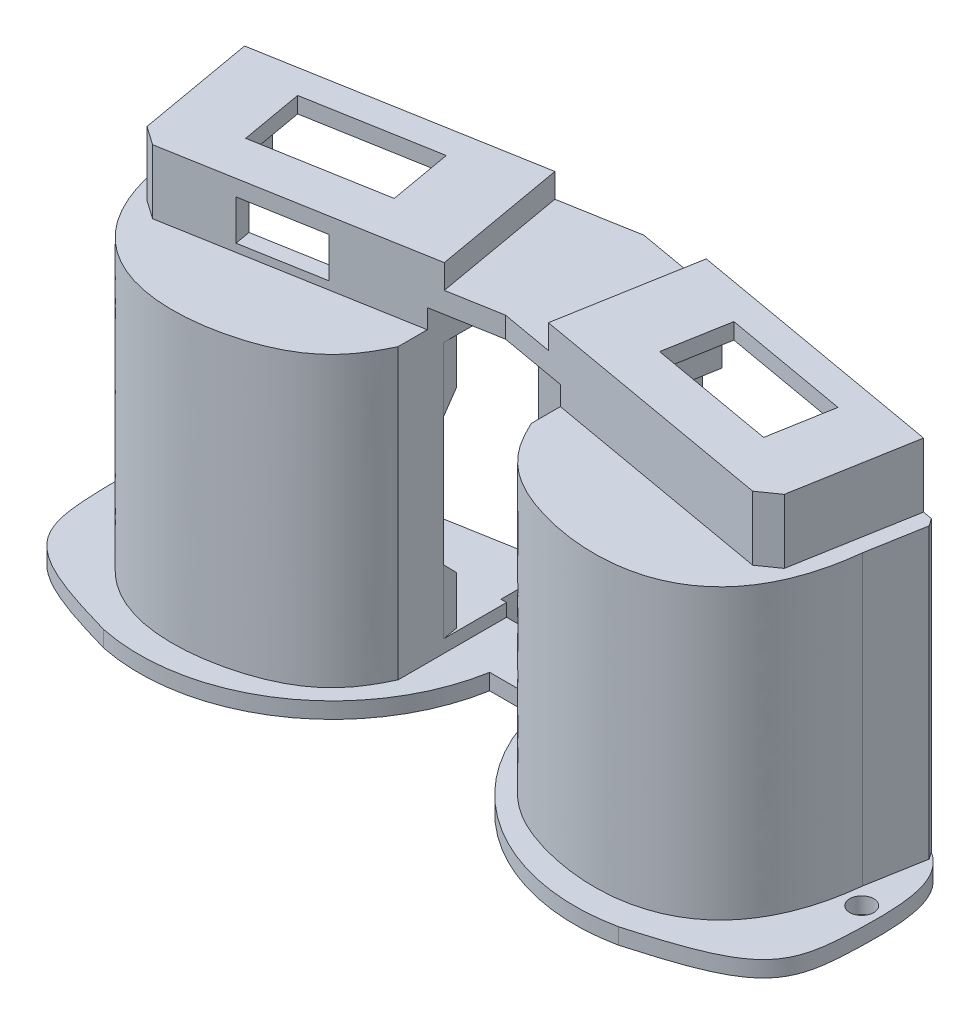
from build123d import *

# Parameters (mm, degrees)
EXTRUDE_1_DEPTH        = 1
EXTRUDE_1_2_DEPTH      = 1
FILLET_1_R             = 2
FILLET_2_R             = 2
SKETCH_6_W             = 6
SKETCH_6_H             = 8
EXTRUDE_2_DEPTH        = 1
EXTRUDE_4_DEPTH        = 18
EXTRUDE_5_DEPTH        = 4
CUT_EXTRUDE_8_DEPTH    = 1.5
SKETCH_24_W            = 8.3
SKETCH_24_H            = 19.2
CUT_EXTRUDE_2271_DEPTH = 10
SKETCH_13_R            = 0.75
CUT_EXTRUDE_14_DEPTH   = 10
SKETCH_29_OUTSIDE_W    = 62.972
SKETCH_29_OUTSIDE_H    = 33.348
CUT_EXTRUDE_20_DEPTH   = 1
SKETCH_25_W            = 9
SKETCH_25_H            = 2
CUT_EXTRUDE_4392_DEPTH = 18
CHAMFER_4_SIZE         = 1
SKETCH_39_W            = 17
SKETCH_39_H            = 16
CUT_EXTRUDE_28_DEPTH   = 7.5
SKETCH_40_W            = 14
SKETCH_40_H            = 4.2
CUT_EXTRUDE_29_DEPTH   = 7.5
SKETCH_43_W            = 3
SKETCH_43_H            = 3
EXTRUDE_10_DEPTH       = 1
SKETCH_44_W            = 4
SKETCH_44_H            = 2.5
EXTRUDE_11_DEPTH       = 1.5
SKETCH_47_R            = 0.5
CUT_EXTRUDE_31_DEPTH   = 2
CUT_EXTRUDE_32_DEPTH   = 6
SKETCH_49_R            = 0.5
CUT_EXTRUDE_33_DEPTH   = 3
SKETCH_50_W            = 5
SKETCH_50_H            = 2.5
CUT_EXTRUDE_34_DEPTH   = 3
CHAMFER_START          = 1
CHAMFER_6_DEPTH        = 19
CHAMFER_7_SIZE         = 1


with BuildPart() as part:
    # 草图1 → 凸台-拉伸1 (new body)
    with BuildSketch(Plane(origin=(0, 0, 0), x_dir=(1, 0, 0), z_dir=(0, 1, 0))):
        with BuildLine():
            Line((2.5, 0), (19.241731801, -2.95201902))
            add(Edge.make_bspline(
                [(16.289712781, -19.693750822), (21.129770718, -18.30937539), (24.365467079, -17.036880795), (24.930319354, -7.375094408), (24.280515787, -3.921767395), (19.241731801, -2.95201902)],
                knots=[0, 0, 0, 0, 0.38424731, 0.48424731, 1, 1, 1, 1], degree=3))
            ThreePointArc((16.289712781, -19.693750822), (2.883637018, -14.406080298), (2.5, 0))
        make_face()
    extrude(amount=EXTRUDE_1_DEPTH)

    # 圆角2
    fillet_2_edges = [part.edges().sort_by_distance(p)[0] for p in [
        (2.5, 0.5, 0),
    ]]
    fillet(fillet_2_edges, radius=FILLET_2_R)



with BuildPart() as body_2:
    # 草图1 → Extrude 1 2 (new body)
    with BuildSketch(Plane(origin=(0, 0, 0), x_dir=(1, 0, 0), z_dir=(0, 1, 0))):
        with BuildLine():
            Line((-2.5, 0), (-19.241731801, -2.95201902))
            add(Edge.make_bspline(
                [(-16.289712781, -19.693750822), (-21.129770718, -18.30937539), (-24.365467079, -17.036880795), (-24.930319354, -7.375094408), (-24.280515787, -3.921767395), (-19.241731801, -2.95201902)],
                knots=[0, 0, 0, 0, 0.38424731, 0.48424731, 1, 1, 1, 1], degree=3))
            ThreePointArc((-16.289712781, -19.693750822), (-2.883637018, -14.406080298), (-2.5, 0))
        make_face()
    extrude(amount=EXTRUDE_1_2_DEPTH)

    # 圆角1
    fillet_1_edges = [body_2.edges().sort_by_distance(p)[0] for p in [
        (-2.5, 0.5, 0),
    ]]
    fillet(fillet_1_edges, radius=FILLET_1_R)


with BuildPart() as part_1:
    add(part.part)

    add(body_2.part)  # 凸台-拉伸2 merges body 2
    # 草图6 → 凸台-拉伸2 (add)
    with BuildSketch(Plane(origin=(0, 0, 0), x_dir=(1, 0, 0), z_dir=(0, 1, 0))):
        with Locations((0, -6)):
            Rectangle(SKETCH_6_W, SKETCH_6_H)
    extrude(amount=EXTRUDE_2_DEPTH)

    # 草图15 → 凸台-拉伸4 (add)
    with BuildSketch(Plane(origin=(0, 1, 0), x_dir=(1, 0, 0), z_dir=(0, 1, 0))):
        with BuildLine():
            Line((0, -1.082322466), (22.158174443, -4.989406464))
            Line((22.158174443, -4.989406464), (21.463581732, -8.928637476))
            add(Edge.make_bspline(
                [(21.463581732, -8.928637476), (20.458963338, -18.100563156), (6.612745785, -17.806779428), (4.545635212, -13.166954204), (2.829361228, -9.295442737), (2.745033676, -8.501050368), (2.954423259, -7.69582667)],
                knots=[0, 0, 0, 0, 0.355715303, 0.690613532, 0.755042002, 1, 1, 1, 1], degree=3))
            Line((2.954423259, -7.69582667), (0, -7.174882137))
            Line((0, -7.174882137), (-2.954423259, -7.69582667))
            add(Edge.make_bspline(
                [(-21.463581732, -8.928637476), (-20.458963338, -18.100563156), (-6.612745785, -17.806779428), (-4.545635212, -13.166954204), (-2.829361228, -9.295442737), (-2.745033676, -8.501050368), (-2.954423259, -7.69582667)],
                knots=[0, 0, 0, 0, 0.355715303, 0.690613532, 0.755042002, 1, 1, 1, 1], degree=3))
            Line((-21.463581732, -8.928637476), (-22.158174443, -4.989406464))
            Line((-22.158174443, -4.989406464), (0, -1.082322466))
        make_face()
    extrude(amount=EXTRUDE_4_DEPTH)

    # 草图16 → 凸台-拉伸5 (add)
    with BuildSketch(Plane(origin=(0, 19, 0), x_dir=(1, 0, 0), z_dir=(0, 1, 0))):
        Polygon((0, -1.082322466), (21.17336669, -4.815758286), (19.69735718, -13.186624187), (0, -9.713448667), (-19.69735718, -13.186624187), (-21.17336669, -4.815758286), align=None)
    extrude(amount=EXTRUDE_5_DEPTH)

    # 草图17 → 切除-拉伸8 (cut)
    with BuildSketch(Plane(origin=(0, 23, 0), x_dir=(1, 0, 0), z_dir=(0, 1, 0))):
        Polygon((0, -1.082322466), (4.720647739, -1.914700029), (3.244638229, -10.28556593), (0, -9.713448667), (-3.244638279, -10.28556592), (-4.720647739, -1.914700029), align=None)
    extrude(amount=-CUT_EXTRUDE_8_DEPTH, mode=Mode.SUBTRACT)

    # 草图24 → Cut-Extrude 2271 (cut)
    with BuildSketch(Plane.XY.offset(5)):
        with Locations((0, 10.6)):
            Rectangle(SKETCH_24_W, SKETCH_24_H)
    extrude(amount=CUT_EXTRUDE_2271_DEPTH, mode=Mode.SUBTRACT)

    # 草图13 → 切除-拉伸14 (cut)
    with BuildSketch(Plane.XZ.offset(-1)):
        with Locations(Location((22.5, 10, 0), (0, 0, 270))):
            Circle(SKETCH_13_R)
        with Locations(Location((-22.5, 10, 0), (0, 0, 90))):
            Circle(SKETCH_13_R)
    extrude(amount=CUT_EXTRUDE_14_DEPTH, mode=Mode.SUBTRACT)

    # 草图29 outside → 切除-拉伸20 (cut)
    with BuildSketch(Plane.XZ):
        with Locations((0, 10.098)):
            Rectangle(SKETCH_29_OUTSIDE_W, SKETCH_29_OUTSIDE_H)
        with BuildLine():
            Line((1.702963992, 9), (-1.702963992, 9))
            ThreePointArc((-1.702963992, 9), (-6.81692658, 16.899495511), (-16.049007816, 18.722492691))
            add(Edge.make_bspline(
                [(-16.049007816, 18.722492691), (-16.920025913, 18.473121161), (-17.78914031, 18.217662956), (-19.075850198, 17.780244196), (-19.502068288, 17.6249077), (-20.33615497, 17.280474648), (-20.744836841, 17.091657417), (-21.333105452, 16.759285049), (-21.524991654, 16.640149037), (-21.896670299, 16.377866287), (-22.077277299, 16.233576984), (-22.408411373, 15.923221016), (-22.560329563, 15.756228886), (-22.832571371, 15.394897048), (-22.953902056, 15.198182278), (-23.260109597, 14.583370873), (-23.38720842, 14.147493785), (-23.553865264, 13.246192341), (-23.596863689, 12.79302286), (-23.656166309, 11.887178772), (-23.671885397, 11.433841556), (-23.692971487, 10.526858637), (-23.695815534, 10.073137752), (-23.669767406, 9.164750262), (-23.641021094, 8.707938015), (-23.522406096, 7.804279886), (-23.433534417, 7.357660735), (-23.212324366, 6.706527424), (-23.124774871, 6.496572645), (-22.914786728, 6.094570534), (-22.791278459, 5.901338245), (-22.506656738, 5.541845028), (-22.348740386, 5.37915459), (-22.00509679, 5.084169897), (-21.818073391, 4.951017446), (-21.231651438, 4.595604637), (-20.815073756, 4.418550251), (-19.95339814, 4.131083131), (-19.508411447, 4.021962474), (-19.060264326, 3.93544802)],
                knots=[0, 0, 0, 0, 0.125, 0.125, 0.1875, 0.1875, 0.25, 0.25, 0.28125, 0.28125, 0.3125, 0.3125, 0.34375, 0.34375, 0.375, 0.375, 0.4375, 0.4375, 0.5, 0.5, 0.5625, 0.5625, 0.625, 0.625, 0.6875, 0.6875, 0.75, 0.75, 0.78125, 0.78125, 0.8125, 0.8125, 0.84375, 0.84375, 0.875, 0.875, 0.9375, 0.9375, 1, 1, 1, 1], degree=3))
            Line((-19.060264326, 3.93544802), (-3.739866324, 1.234048497))
            ThreePointArc((-3.739866324, 1.234048497), (-3.105279741, 1.33142412), (-2.660683738, 1.79458342))
            ThreePointArc((-2.660683738, 1.79458342), (-2.400732286, 2.390720531), (-2.173283961, 3))
            Line((-2.173283961, 3), (2.173283961, 3))
            ThreePointArc((2.173283961, 3), (2.400732286, 2.390720531), (2.660683738, 1.79458342))
            ThreePointArc((2.660683738, 1.79458342), (3.105279741, 1.33142412), (3.739866324, 1.234048497))
            Line((3.739866324, 1.234048497), (19.060264326, 3.93544802))
            add(Edge.make_bspline(
                [(19.060264326, 3.93544802), (19.508216734, 4.021924885), (19.949209876, 4.130013985), (20.593817654, 4.344575051), (20.80583512, 4.424951748), (21.222214191, 4.609480673), (21.427618699, 4.714387114), (21.81720082, 4.950476039), (22.002367105, 5.081982754), (22.348522561, 5.378812904), (22.509862914, 5.545621897), (22.791306906, 5.901650038), (22.913464376, 6.092247394), (23.124561611, 6.495957516), (23.213330058, 6.709349312), (23.432492832, 7.354872491), (23.521649384, 7.799848963), (23.640808498, 8.704995167), (23.669482184, 9.159390938), (23.695785918, 10.06757243), (23.693039263, 10.521963617), (23.671996172, 11.431039842), (23.656215156, 11.886330136), (23.596853082, 12.793287312), (23.553751506, 13.245080327), (23.430284393, 13.915382929), (23.377766963, 14.138829281), (23.241740603, 14.574596484), (23.158986036, 14.785731565), (22.95753614, 15.191548255), (22.837395421, 15.387866535), (22.562766455, 15.753605979), (22.410204286, 15.921333626), (22.079661624, 16.231546653), (21.900758382, 16.374775838), (21.527768136, 16.638391617), (21.335353924, 16.757946235), (20.745847427, 17.09122233), (20.336797544, 17.28019005), (19.502562274, 17.624722934), (19.076673871, 17.77995258), (17.789552289, 18.21754609), (16.92022558, 18.473063997), (16.049007816, 18.722492691)],
                knots=[0, 0, 0, 0, 0.0625, 0.0625, 0.09375, 0.09375, 0.125, 0.125, 0.15625, 0.15625, 0.1875, 0.1875, 0.21875, 0.21875, 0.25, 0.25, 0.3125, 0.3125, 0.375, 0.375, 0.4375, 0.4375, 0.5, 0.5, 0.5625, 0.5625, 0.59375, 0.59375, 0.625, 0.625, 0.65625, 0.65625, 0.6875, 0.6875, 0.71875, 0.71875, 0.75, 0.75, 0.8125, 0.8125, 0.875, 0.875, 1, 1, 1, 1], degree=3))
            ThreePointArc((16.049007816, 18.722492691), (6.81692658, 16.899495511), (1.702963992, 9))
        make_face(mode=Mode.SUBTRACT)
    extrude(amount=-CUT_EXTRUDE_20_DEPTH, mode=Mode.SUBTRACT)

    # 草图25 → Cut-Extrude 4392 (cut)
    with BuildSketch(Plane.XZ):
        with Locations((0, 4.5)):
            Rectangle(SKETCH_25_W, SKETCH_25_H)
    extrude(amount=-CUT_EXTRUDE_4392_DEPTH, mode=Mode.SUBTRACT)

    # 倒角4
    chamfer_4_edges = [part_1.edges().sort_by_distance(p)[0] for p in [
        (-19.69735718, 21, 13.186624187),
        (19.69735718, 21, 13.186624187),
    ]]
    chamfer(chamfer_4_edges, length=CHAMFER_4_SIZE)

    # 草图39 → 切除-拉伸28 (cut)
    with BuildSketch(Plane(origin=(-0.185088042, 0, 1.04968645), x_dir=(-0.9848077530122081, 0, -0.17364817766693072), z_dir=(0.17364817766693072, 0, -0.9848077530122081))):
        with Locations((-13.187943324, 9.8)):
            Rectangle(SKETCH_39_W, SKETCH_39_H)
    cut_extrude_28 = extrude(amount=-CUT_EXTRUDE_28_DEPTH, mode=Mode.SUBTRACT)

    # 镜向9: 切除-拉伸28 across plane
    add(cut_extrude_28.mirror(Plane(origin=(0, 0, 0), x_dir=(0, 0, 1), z_dir=(1, 0, 0))), mode=Mode.SUBTRACT)

    # 草图40 → 切除-拉伸29 (cut)
    with BuildSketch(Plane(origin=(-0.185088042, 0, 1.04968645), x_dir=(-0.9848077530122081, 0, -0.17364817766693072), z_dir=(0.17364817766693072, 0, -0.9848077530122081))):
        with Locations((-13.187943324, 19.9)):
            Rectangle(SKETCH_40_W, SKETCH_40_H)
    cut_extrude_29 = extrude(amount=-CUT_EXTRUDE_29_DEPTH, mode=Mode.SUBTRACT)

    # 镜向10: 切除-拉伸29 across plane
    add(cut_extrude_29.mirror(Plane(origin=(0, 0, 0), x_dir=(0, 0, 1), z_dir=(1, 0, 0))), mode=Mode.SUBTRACT)

    # 草图43 → 凸台-拉伸10 (add)
    with BuildSketch(Plane(origin=(1.487449375, 0, 8.435744598), x_dir=(-0.9848077530122081, 0, 0.17364817766693064), z_dir=(-0.17364817766693064, 0, -0.9848077530122081))):
        with Locations((20.187943324, 3.3)):
            Rectangle(SKETCH_43_W, SKETCH_43_H)
        with Locations((20.187943324, 16.3)):
            Rectangle(SKETCH_43_W, SKETCH_43_H)
        with Locations((7.224416119, 3.3)):
            Rectangle(SKETCH_43_W, SKETCH_43_H)
        with Locations((7.224416119, 16.3)):
            Rectangle(SKETCH_43_W, SKETCH_43_H)
    extrude(amount=EXTRUDE_10_DEPTH)

    # 草图44 → 凸台-拉伸11 (add)
    with BuildSketch(Plane(origin=(-1.487449375, 0, 8.435744598), x_dir=(-0.9848077530122081, 0, -0.17364817766693064), z_dir=(0.17364817766693064, 0, -0.9848077530122081))):
        with Locations((-18.187943324, 20.75)):
            Rectangle(SKETCH_44_W, SKETCH_44_H)
        with Locations((-19.687943324, 3.05)):
            Rectangle(SKETCH_44_W, SKETCH_44_H)
        with Locations((-8.187943324, 20.75)):
            Rectangle(SKETCH_44_W, SKETCH_44_H)
        with Locations((-7.724416119, 3.05)):
            Rectangle(SKETCH_44_W, SKETCH_44_H)
    extrude(amount=EXTRUDE_11_DEPTH)

    # 草图47 → 切除-拉伸31 (cut)
    with BuildSketch(Plane(origin=(-1.226977108, 0, 6.958532968), x_dir=(-0.984807753012208, 0, -0.17364817766693086), z_dir=(0.17364817766693086, 0, -0.984807753012208))):
        with Locations((-18.687943324, 20.679783186)):
            Circle(SKETCH_47_R)
        with Locations(Location((-7.687943324, 2.979783186, 0), (0, 0, 180))):
            Circle(SKETCH_47_R)
        with Locations(Location((-8.687943324, 20.679783186, 0), (0, 0, 180))):
            Circle(SKETCH_47_R)
        with Locations((-19.687943324, 2.979783186)):
            Circle(SKETCH_47_R)
    extrude(amount=-CUT_EXTRUDE_31_DEPTH, mode=Mode.SUBTRACT)

    # 草图48 → 切除-拉伸32 (cut)
    with BuildSketch(Plane(origin=(0, 23, 0), x_dir=(1, 0, 0), z_dir=(0, 1, 0))):
        Polygon((-8.27438755, -8.380023258), (-16.152849574, -9.76920868), (-16.847442285, -5.829977668), (-8.968980261, -4.440792246), align=None)
    cut_extrude_32 = extrude(amount=-CUT_EXTRUDE_32_DEPTH, mode=Mode.SUBTRACT)

    # 镜向8: 切除-拉伸32 across plane
    add(cut_extrude_32.mirror(Plane(origin=(0, 0, 0), x_dir=(0, 0, 1), z_dir=(1, 0, 0))), mode=Mode.SUBTRACT)

    # 草图49 → 切除-拉伸33 (cut)
    with BuildSketch(Plane(origin=(1.313801197, 0, 7.450936845), x_dir=(-0.9848077530122079, 0, 0.17364817766693114), z_dir=(-0.17364817766693114, 0, -0.9848077530122079))):
        with Locations((7.556179721, 3.6)):
            Circle(SKETCH_49_R)
        with Locations(Location((20.056179721, 3.6, 0), (0, 0, 180))):
            Circle(SKETCH_49_R)
        with Locations((7.556179721, 16.1)):
            Circle(SKETCH_49_R)
        with Locations(Location((20.056179721, 16.1, 0), (0, 0, 180))):
            Circle(SKETCH_49_R)
    extrude(amount=-CUT_EXTRUDE_33_DEPTH, mode=Mode.SUBTRACT)

    # 草图50 → 切除-拉伸34 (cut)
    with BuildSketch(Plane(origin=(1.661097553, 0, 9.420552351), x_dir=(0.9848077530122081, 0, -0.17364817766693064), z_dir=(0.17364817766693064, 0, 0.9848077530122081))):
        with Locations((-13.69565105, 20.75)):
            Rectangle(SKETCH_50_W, SKETCH_50_H)
    extrude(amount=-CUT_EXTRUDE_34_DEPTH, mode=Mode.SUBTRACT)

    # 倒角6: read off the stored shape, not the designer's step
    # 倒角6 outline → 倒角6 (cut)
    with BuildSketch(Plane(origin=(0, 0, 0), x_dir=(1, 0, 0), z_dir=(0, 1, 0)).offset(CHAMFER_START)):
        Polygon((22.158174443, -4.989406464), (21.764251342, -4.919947193), (22.088715172, -5.383329565), align=None)
        Polygon((-22.158174443, -4.989406464), (-22.088715172, -5.383329565), (-21.764251342, -4.919947192), align=None)
    extrude(amount=CHAMFER_6_DEPTH, mode=Mode.SUBTRACT)

    # 倒角7
    chamfer_7_edges = [part_1.edges().sort_by_distance(p)[0] for p in [
        (-18.393793728, 14.8, 11.941344167),
        (-5.62721163, 14.8, 9.690251292),
        (-18.393793728, 4.8, 11.941344167),
        (-5.62721163, 4.8, 9.690251292),
        (6.119615506, 4.3, 9.77707538),
        (17.901389851, 4.3, 11.854520078),
        (6.576100692, 19.5, 9.857566035),
        (16.424178222, 19.5, 11.594047812),
    ]]
    chamfer(chamfer_7_edges, length=CHAMFER_7_SIZE - 0.0001)  # a hair under: the kernel refuses the full size


solid = part_1.part
